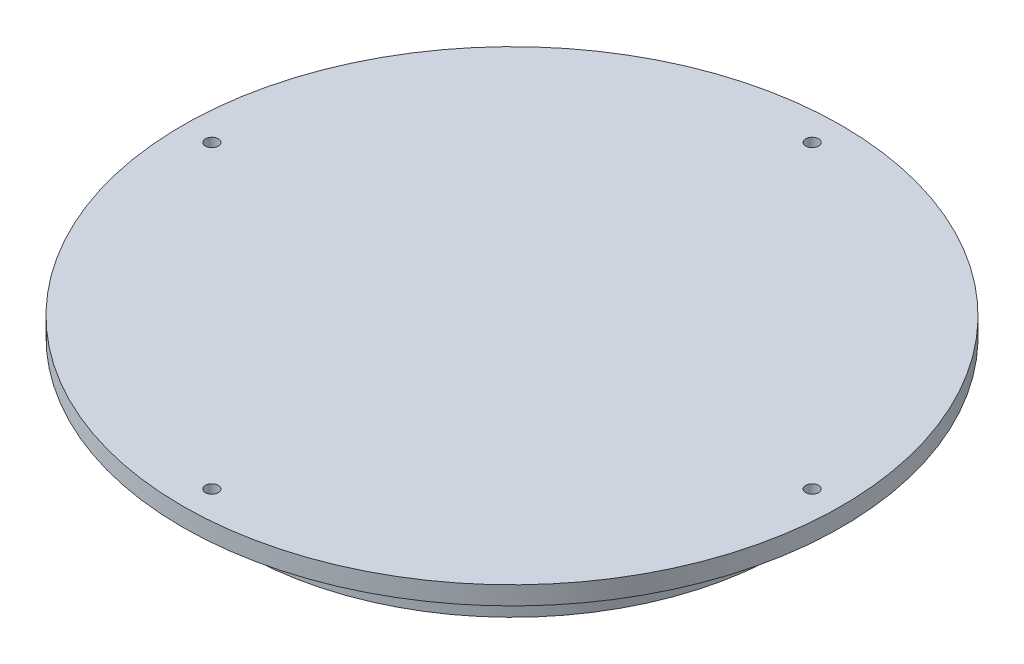
from build123d import *

# Parameters (mm, degrees)
SKETCH1_R           = 90
SKETCH1_R_2         = 64
BOSS_EXTRUDE1_DEPTH = 18
SKETCH2_R           = 90
BOSS_EXTRUDE2_DEPTH = 1
SKETCH3_R           = 90
SKETCH3_R_2         = 74
CUT_EXTRUDE1_DEPTH  = 14
SKETCH4_W           = 10
SKETCH4_H           = 5
SKETCH4_W_2         = 5
SKETCH4_H_2         = 10
BOSS_EXTRUDE3_DEPTH = 2
FILLET1_R           = 2
SKETCH5_R           = 1.75
CUT_EXTRUDE2_DEPTH  = 75


with BuildPart() as part:
    # Sketch1 → Boss-Extrude1 (new body)
    with BuildSketch(Plane(origin=(0, 0, 0), x_dir=(1, 0, 0), z_dir=(0, 1, 0))):
        with Locations(Location((0, 0, 0), (0, 0, 270))):
            Circle(SKETCH1_R)
        with Locations(Location((0, 0, 0), (0, 0, 270))):
            Circle(SKETCH1_R_2, mode=Mode.SUBTRACT)
    extrude(amount=BOSS_EXTRUDE1_DEPTH)

    # Sketch2 → Boss-Extrude2 (add)
    with BuildSketch(Plane(origin=(0, 18, 0), x_dir=(1, 0, 0), z_dir=(0, 1, 0))):
        with Locations(Location((0, 0, 0), (0, 0, 270))):
            Circle(SKETCH2_R)
    extrude(amount=BOSS_EXTRUDE2_DEPTH)

    # Sketch3 → Cut-Extrude1 (cut)
    with BuildSketch(Plane.XZ):
        with Locations(Location((0, 0, 0), (0, 0, 270))):
            Circle(SKETCH3_R)
        with Locations(Location((0, 0, 0), (0, 0, 270))):
            Circle(SKETCH3_R_2, mode=Mode.SUBTRACT)
    extrude(amount=-CUT_EXTRUDE1_DEPTH, mode=Mode.SUBTRACT)

    # Sketch4 → Boss-Extrude3 (add)
    with BuildSketch(Plane.XZ):
        with Locations((0, 64)):
            Rectangle(SKETCH4_W, SKETCH4_H)
        with Locations((-64, 0)):
            Rectangle(SKETCH4_W_2, SKETCH4_H_2)
        with Locations((64, 0)):
            Rectangle(SKETCH4_W_2, SKETCH4_H_2)
        with Locations((0, -64)):
            Rectangle(SKETCH4_W, SKETCH4_H)
    extrude(amount=-BOSS_EXTRUDE3_DEPTH)

    # Fillet1
    # the kernel refuses this fillet: 2 mm, written as the material it takes off along each edge
    with BuildSketch(Plane(origin=(-61.5, 0, 5), x_dir=(-1, 0, 0), z_dir=(0, 0, -1)), Plane(origin=(-5, 2, 61.5), x_dir=(0, 0, 1), z_dir=(1, 0, 0)), Plane(origin=(61.5, 2, 5), x_dir=(1, 0, 0), z_dir=(0, 0, -1)), Plane(origin=(5, 2, -61.5), x_dir=(0, 0, -1), z_dir=(-1, 0, 0))) as fillet1_piece_1:
        with BuildLine():
            CenterArc((FILLET1_R, FILLET1_R), FILLET1_R, 180, 90)
            Line((0, FILLET1_R), (0, 0))
            Line((0, 0), (FILLET1_R, 0))
        make_face()
    extrude(amount=10, mode=Mode.SUBTRACT)
    with BuildSketch(Plane(origin=(-61.5, 2, 5), x_dir=(-1, 0, 0), z_dir=(0, 0, -1)), Plane(origin=(-5, 0, 61.5), x_dir=(0, 0, 1), z_dir=(1, 0, 0)), Plane(origin=(61.5, 0, 5), x_dir=(1, 0, 0), z_dir=(0, 0, -1)), Plane(origin=(5, 0, -61.5), x_dir=(0, 0, -1), z_dir=(-1, 0, 0))) as fillet1_piece_2:
        with BuildLine():
            CenterArc((FILLET1_R, -FILLET1_R), FILLET1_R, 90, 90)
            Line((0, -FILLET1_R), (0, 0))
            Line((0, 0), (FILLET1_R, 0))
        make_face()
    extrude(amount=10, mode=Mode.SUBTRACT)
    with BuildSketch(Plane(origin=(-61.5, -5, 5), x_dir=(-1, 0, 0), z_dir=(0, 1, 0)), Plane(origin=(5, -5, 61.5), x_dir=(0, 0, 1), z_dir=(0, 1, 0)), Plane(origin=(61.5, -5, -5), x_dir=(1, 0, 0), z_dir=(0, 1, 0)), Plane(origin=(-5, -5, -61.5), x_dir=(0, 0, -1), z_dir=(0, 1, 0))) as fillet1_piece_3:
        with BuildLine():
            CenterArc((FILLET1_R, -FILLET1_R), FILLET1_R, 90, 90)
            Line((0, -FILLET1_R), (0, 0))
            Line((0, 0), (FILLET1_R, 0))
        make_face()
    extrude(amount=12, mode=Mode.SUBTRACT)
    with BuildSketch(Plane(origin=(-61.5, -5, -5), x_dir=(-1, 0, 0), z_dir=(0, 1, 0)), Plane(origin=(-5, -5, 61.5), x_dir=(0, 0, 1), z_dir=(0, 1, 0)), Plane(origin=(61.5, -5, 5), x_dir=(1, 0, 0), z_dir=(0, 1, 0)), Plane(origin=(5, -5, -61.5), x_dir=(0, 0, -1), z_dir=(0, 1, 0))) as fillet1_piece_4:
        with BuildLine():
            CenterArc((FILLET1_R, FILLET1_R), FILLET1_R, 180, 90)
            Line((0, FILLET1_R), (0, 0))
            Line((0, 0), (FILLET1_R, 0))
        make_face()
    extrude(amount=12, mode=Mode.SUBTRACT)

    # Sketch5 → Cut-Extrude2 (cut)
    with BuildSketch(Plane.XZ.offset(-14)):
        with Locations(Location((0, 81.969345849, 0), (0, 0, 270))):
            Circle(SKETCH5_R)
        with Locations(Location((81.969345849, 0, 0), (0, 0, 270))):
            Circle(SKETCH5_R)
        with Locations(Location((0, -81.969345849, 0), (0, 0, 270))):
            Circle(SKETCH5_R)
        with Locations(Location((-81.969345849, 0, 0), (0, 0, 270))):
            Circle(SKETCH5_R)
    extrude(amount=-CUT_EXTRUDE2_DEPTH, mode=Mode.SUBTRACT)


solid = part.part
